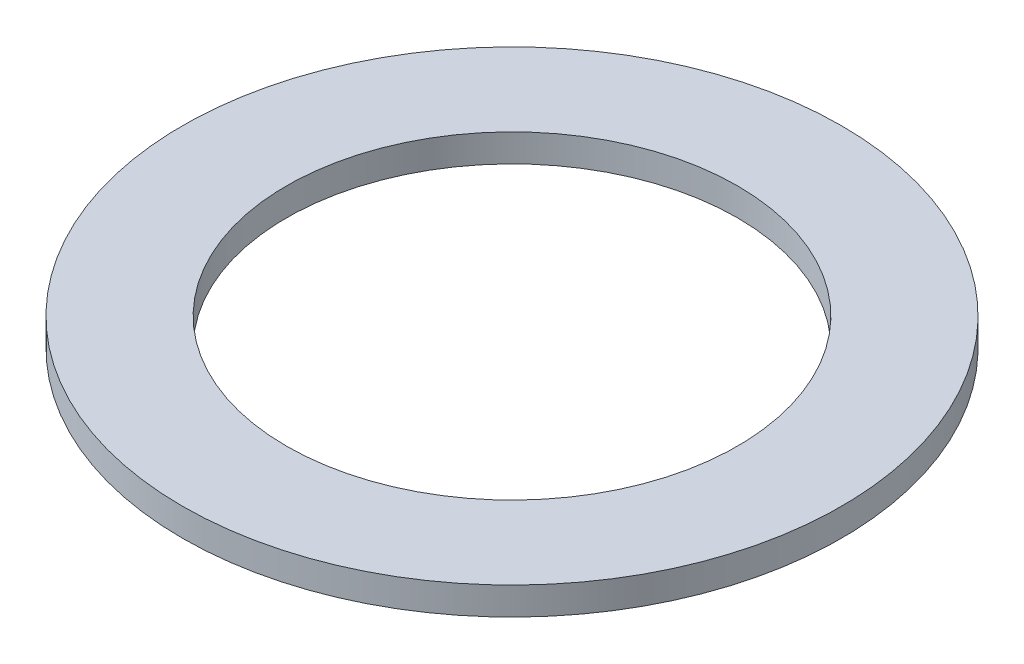
from build123d import *

# Parameters (mm, degrees)
SKETCH1_R           = 47.5
BOSS_EXTRUDE1_DEPTH = 4
SKETCH2_R           = 32.5
CUT_EXTRUDE1_DEPTH  = 68.294130502


with BuildPart() as part:
    # Sketch1 → Boss-Extrude1 (new body)
    with BuildSketch(Plane(origin=(0, 0, 0), x_dir=(1, 0, 0), z_dir=(0, 1, 0))):
        Circle(SKETCH1_R)
    extrude(amount=BOSS_EXTRUDE1_DEPTH)

    # Sketch2 → Cut-Extrude1 (cut, through all)
    with BuildSketch(Plane(origin=(0, 0, 0), x_dir=(1, 0, 0), z_dir=(0, 1, 0))):
        Circle(SKETCH2_R)
    extrude(amount=CUT_EXTRUDE1_DEPTH, mode=Mode.SUBTRACT)


solid = part.part
